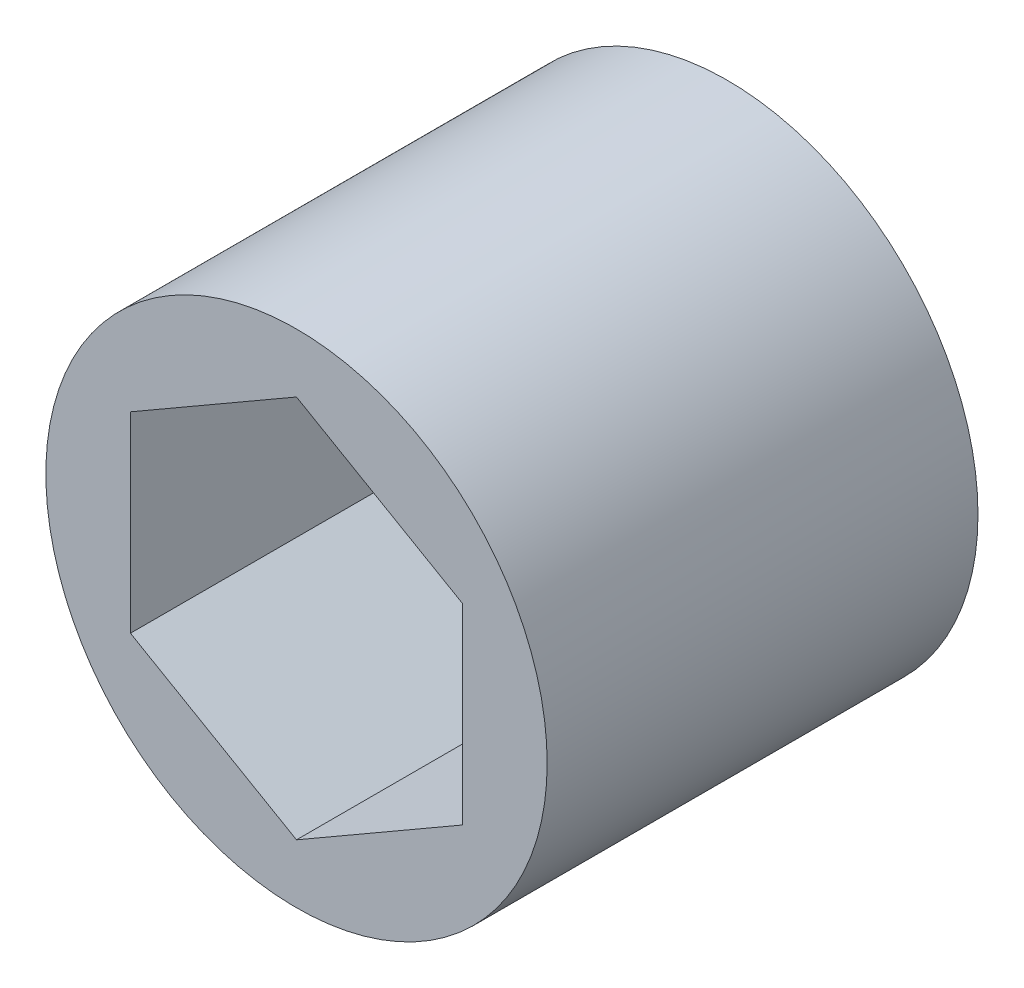
from build123d import *

# Parameters (mm, degrees)
SKETCH1_R           = 10.16
BOSS_EXTRUDE1_DEPTH = 8.73125


with BuildPart() as part:
    # Sketch1 → Boss-Extrude1 (new, symmetric)
    with BuildSketch(Plane.XY):
        Circle(SKETCH1_R)
        Polygon((0, 7.772289324), (-6.731, 3.886144662), (-6.731, -3.886144662), (0, -7.772289324), (6.731, -3.886144662), (6.731, 3.886144662), align=None, mode=Mode.SUBTRACT)
    extrude(amount=BOSS_EXTRUDE1_DEPTH, both=True)


solid = part.part
